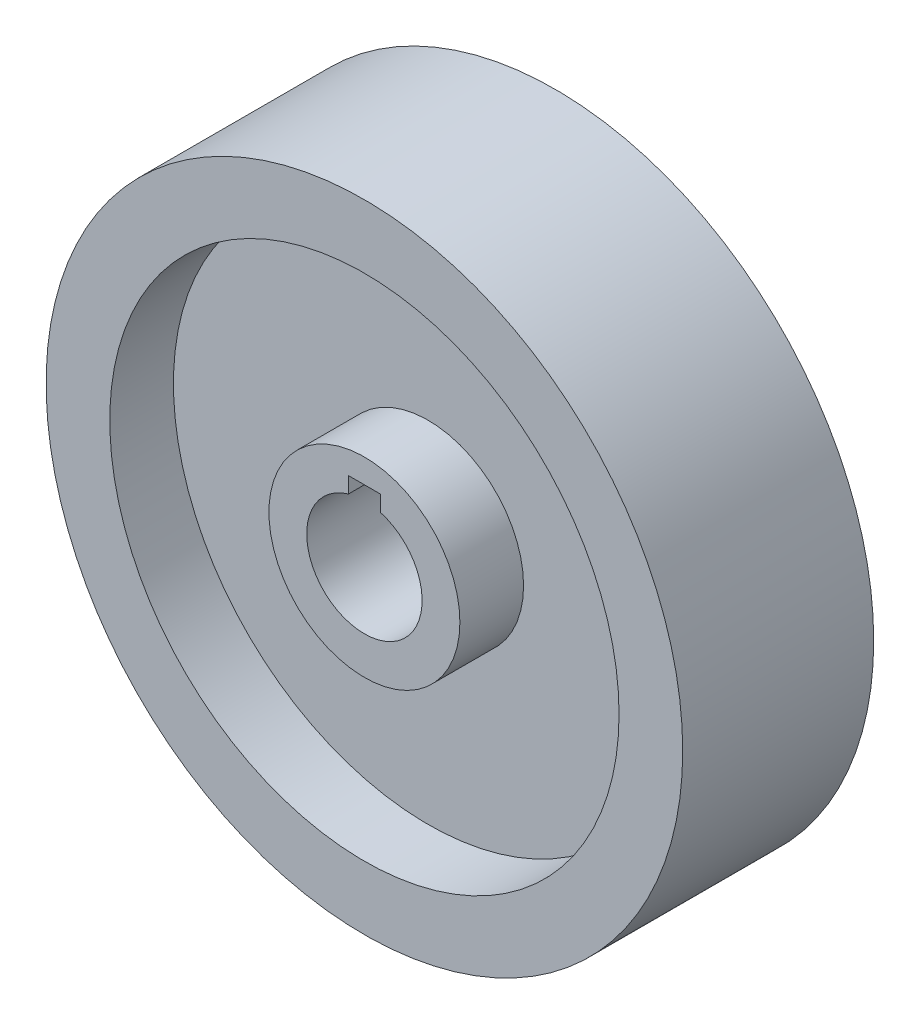
from build123d import *

# Parameters (mm, degrees)
SKETCH4_W          = 6.35
SKETCH4_H          = 3.175
CUT_EXTRUDE1_DEPTH = 98.550550998


with BuildPart() as part:
    # Sketch1 → Revolve1 (revolve)
    with BuildSketch(Plane(origin=(0, 0, 0), x_dir=(0, 0, -1), z_dir=(1, 0, 0))):
        Polygon((19.05, 11.509375), (-19.05, 11.509375), (-19.05, 19.05), (-6.35, 19.05), (-6.35, 50.8), (-19.05, 50.8), (-19.05, 63.5), (19.05, 63.5), (19.05, 50.8), (6.35, 50.8), (6.35, 19.05), (19.05, 19.05), align=None)
    revolve(axis=Axis((0, 0, 34.214514903), (0, 0, -1)))

    # Sketch4 → Cut-Extrude1 (cut, through all)
    with BuildSketch(Plane(origin=(0, 0, -19.05), x_dir=(-1, 0, 0), z_dir=(0, 0, -1))):
        with Locations((0, 12.650279393)):
            Rectangle(SKETCH4_W, SKETCH4_H)
    extrude(amount=-CUT_EXTRUDE1_DEPTH, mode=Mode.SUBTRACT)


solid = part.part
